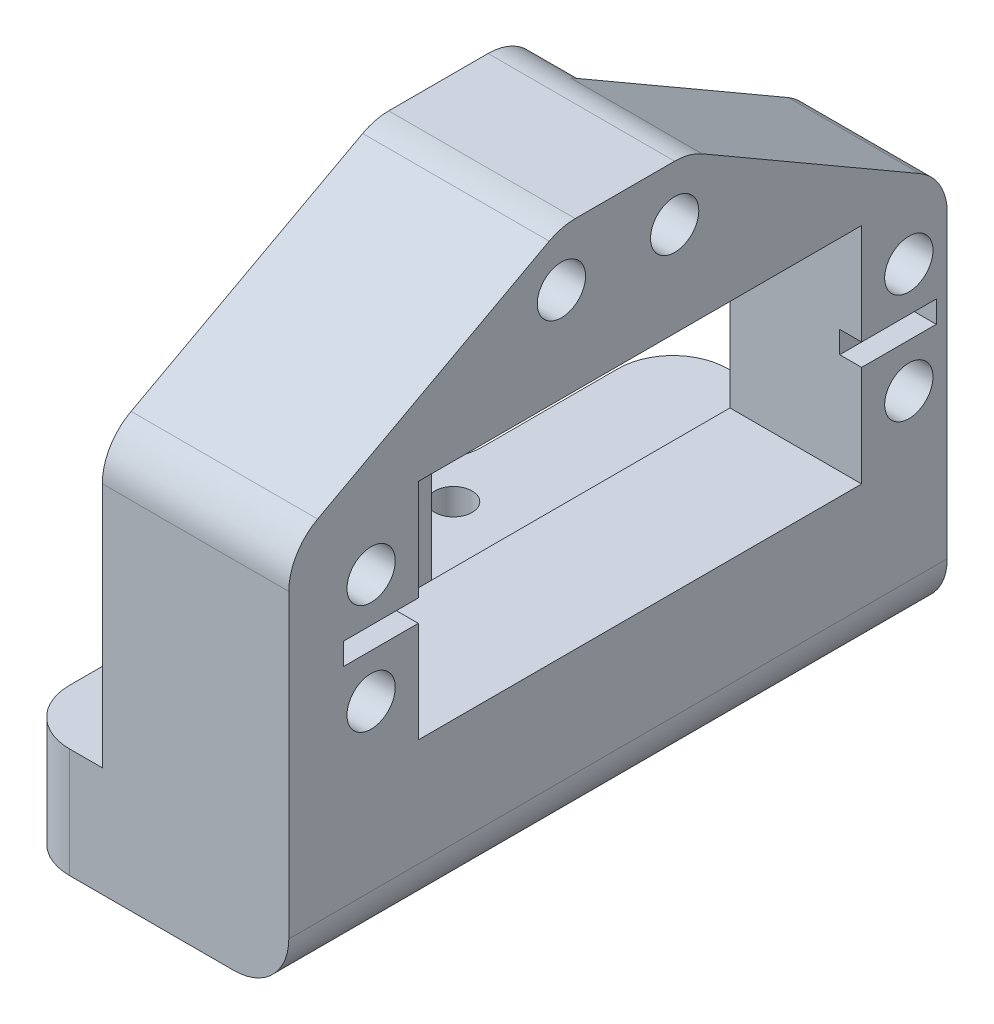
from build123d import *
from build123d.topology import SkipClean

# Parameters (mm, degrees)
SKETCH_1_W           = 20
SKETCH_1_H           = 60.00000000000001
SKETCH_1_R           = 1.7000000000000004
SKETCH_1_R_2         = 1.7
EXTRUDE_1_DEPTH      = 10
SKETCH_6_W           = 60.00000000000001
SKETCH_6_H           = 50.00000000000001
EXTRUDE_4_DEPTH      = 12
SKETCH_7_R           = 2.200000000000002
SKETCH_7_R_2         = 2.2
CUT_EXTRUDE_3_DEPTH  = 67.51315659326356
EXTRUDE_5_OUTLINE_R  = 2.2
EXTRUDE_5_DEPTH      = 5
CUT_EXTRUDE_7_DEPTH  = 5
SKETCH_14_R          = 2.2
CUT_EXTRUDE_8_DEPTH  = 5
CUT_EXTRUDE_START    = -17
CUT_EXTRUDE_9_DEPTH  = 17
SKETCH_18_W          = 6.800000000000008
SKETCH_18_H          = 2.000000000000014
SKETCH_18_W_2        = 6.799999999999994
SKETCH_18_H_2        = 2.0000000000000036
EXTRUDE_10_DEPTH     = 10
CUT_EXTRUDE_10_DEPTH = 62.35829229692095
CUT_EXTRUDE_11_DEPTH = 3.3
FILLET_1_R           = 5
FILLET_2_R           = 3


# Read off the part's stored shape, not the designer's step: 凸台-拉伸5
with BuildPart() as part:
    # 草图1 → 凸台-拉伸1 (new body)
    with BuildSketch(Plane(origin=(0, 0, 0), x_dir=(1, 0, 0), z_dir=(0, 1, 0))):
        Rectangle(SKETCH_1_W, SKETCH_1_H)
        with Locations(Location((-7.000000000000025, 5.2e-15, 0), (0, 0, 270))):
            Circle(SKETCH_1_R, mode=Mode.SUBTRACT)
        with Locations(Location((-2.429e-14, 5.2e-15, 0), (0, 0, 270))):
            Circle(SKETCH_1_R_2, mode=Mode.SUBTRACT)
        with Locations(Location((2.949e-14, 7.000000000000025, 0), (0, 0, 270))):
            Circle(SKETCH_1_R, mode=Mode.SUBTRACT)
        with Locations(Location((-4.48e-15, -7.000000000000048, 0), (0, 0, 270))):
            Circle(SKETCH_1_R, mode=Mode.SUBTRACT)
    extrude(amount=EXTRUDE_1_DEPTH)

    # 草图6 → 凸台-拉伸4 (add)
    with BuildSketch(Plane(origin=(10, 0, 0), x_dir=(0, 0, -1), z_dir=(1, 0, 0))):
        with Locations((0, 25.000000000000004)):
            Rectangle(SKETCH_6_W, SKETCH_6_H)
    extrude(amount=EXTRUDE_4_DEPTH)

    # 草图7 → 切除-拉伸3 (cut, through all)
    with BuildSketch(Plane(origin=(22, 0, 0), x_dir=(0, 0, -1), z_dir=(1, 0, 0))):
        with Locations((-22.500000000000014, 30)):
            Circle(SKETCH_7_R)
        with Locations((-22.500000000000014, 20)):
            Circle(SKETCH_7_R)
        Polygon((-18.20000000000001, 14.8), (22.199999999999985, 14.800000000000002), (22.199999999999985, 35.2), (-18.20000000000001, 35.2), align=None)
        with Locations((26.49999999999999, 30.000000000000007)):
            Circle(SKETCH_7_R)
        with Locations((26.49999999999999, 20.000000000000004)):
            Circle(SKETCH_7_R)
        Polygon((22.199999999999985, 26.00000000000001), (22.199999999999985, 23.999999999999996), (28.999999999999986, 24.000000000000004), (28.99999999999999, 26.00000000000001), align=None)
        Polygon((-25.000000000000014, 24), (-18.200000000000014, 24), (-18.20000000000001, 26.000000000000004), (-25.000000000000014, 26.000000000000004), align=None)
        with Locations((-5.159597133486693, 43.79385241571819)):
            Circle(SKETCH_7_R_2)
        with Locations((5.159597133486693, 43.79385241571819)):
            Circle(SKETCH_7_R_2)
    extrude(amount=-CUT_EXTRUDE_3_DEPTH, mode=Mode.SUBTRACT)

    # 凸台-拉伸5 outline → 凸台-拉伸5 (add)
    with SkipClean():  # the faces are left unmerged after this step: merging them gives an invalid solid
        with BuildSketch(Plane.ZY.offset(-10)):
            with BuildLine():
                Line((30, 10), (30, 35.4))
                Line((30, 35.4), (5.159597133, 48.793852416))
                Line((5.159597133, 48.793852416), (-5.159597133, 48.793852416))
                ThreePointArc((-5.159597133, 48.793852416), (-10.159597133, 43.793852416), (-5.159597133, 38.793852416))
                Line((-5.159597133, 38.793852416), (5, 38.793852416))
                Line((5, 38.793852416), (5, 10))
                Line((5, 10), (30, 10))
            make_face()
            with Locations((22.5, 20)):
                Circle(EXTRUDE_5_OUTLINE_R, mode=Mode.SUBTRACT)
            with Locations((-5.159597133, 43.793852416)):
                Circle(EXTRUDE_5_OUTLINE_R, mode=Mode.SUBTRACT)
            with Locations((5.159597133, 43.793852416)):
                Circle(EXTRUDE_5_OUTLINE_R, mode=Mode.SUBTRACT)
            with Locations((22.5, 30)):
                Circle(EXTRUDE_5_OUTLINE_R, mode=Mode.SUBTRACT)
        extrude(amount=EXTRUDE_5_DEPTH)

    # 草图13 → 切除-拉伸7 (cut)
    with BuildSketch(Plane.ZY.offset(-5)):
        with BuildLine():
            Line((26.400000000000016, 30), (26.400000000000016, 20))
            ThreePointArc((26.400000000000016, 20), (22.500000000000014, 16.099999999999998), (18.600000000000012, 20))
            Line((18.600000000000012, 20), (18.60000000000001, 30))
            ThreePointArc((18.60000000000001, 30), (22.500000000000014, 33.900000000000006), (26.400000000000016, 30))
        make_face()
    extrude(amount=-CUT_EXTRUDE_7_DEPTH, mode=Mode.SUBTRACT)

    # 草图14 → 切除-拉伸8 (cut)
    with BuildSketch(Plane(origin=(10, 0, 0), x_dir=(0, 0, -1), z_dir=(1, 0, 0))):
        with Locations((-11.800000000000018, 25)):
            Circle(SKETCH_14_R)
    extrude(amount=-CUT_EXTRUDE_8_DEPTH, mode=Mode.SUBTRACT)

    # 草图16 → 切除-拉伸9 (cut)
    with BuildSketch(Plane.ZY.offset(-5).offset(CUT_EXTRUDE_START)):
        with BuildLine():
            Line((5.159597133486693, 48.793852415718185), (30, 35.40000000000001))
            Line((30, 35.40000000000001), (30, 50))
            Line((30, 50), (-30, 50))
            Line((-30, 50), (-29.999999999999996, 35.2))
            Line((-29.999999999999996, 35.2), (-7.663336701878596, 48.121818239713186))
            ThreePointArc((-7.663336701878596, 48.121818239713186), (-6.455778231949604, 48.622922156360524), (-5.1595971334867095, 48.793852415718185))
            Line((-5.1595971334867095, 48.793852415718185), (5.159597133486693, 48.793852415718185))
        make_face()
    extrude(amount=CUT_EXTRUDE_9_DEPTH, mode=Mode.SUBTRACT)

    # 草图18 → 凸台-拉伸10 (add)
    with BuildSketch(Plane.ZY.offset(-10)):
        with Locations((-25.599999999999987, 25.000000000000004)):
            Rectangle(SKETCH_18_W, SKETCH_18_H)
        with Locations((21.60000000000001, 25)):
            Rectangle(SKETCH_18_W_2, SKETCH_18_H_2)
    extrude(amount=-EXTRUDE_10_DEPTH)

    # 草图19 → 切除-拉伸10 (cut, through all)
    with BuildSketch(Plane.XZ):
        with BuildLine():
            Line((-3.0000000000000244, 9.539392014169463), (-3.0000000000000244, 30))
            Line((-3.0000000000000244, 30), (-10, 30))
            Line((-10, 30), (-10, -1.2700383e-09))
            ThreePointArc((-10.000000000000028, -1.27003874e-09), (-8.06225774867426, 5.916079782587651), (-3.000000000000024, 9.539392014169465))
        make_face()
        with BuildLine():
            ThreePointArc((-3.0000000000000244, -9.539392014169461), (-8.062257747922892, -5.916079783611588), (-10.000000000000028, -1.27003874e-09))
            Line((-10, -1.2700383e-09), (-10, -30))
            Line((-10, -30), (-3.000000000000025, -30))
            Line((-3.0000000000000244, -30), (-3.0000000000000244, -9.539392014169465))
        make_face()
    extrude(amount=-CUT_EXTRUDE_10_DEPTH, mode=Mode.SUBTRACT)

    # 草图20 → 切除-拉伸11 (cut)
    with BuildSketch(Plane(origin=(10, 0, 0), x_dir=(0, 0, -1), z_dir=(1, 0, 0))):
        Polygon((-7.643078061834704, 24.999999999999993), (-9.721539030917363, 28.600000000000012), (-13.878460969082674, 28.600000000000012), (-15.956921938165337, 24.999999999999993), (-13.878460969082676, 21.399999999999984), (-9.721539030917361, 21.399999999999984), align=None)
    extrude(amount=-CUT_EXTRUDE_11_DEPTH, mode=Mode.SUBTRACT)

    # 圆角1
    fillet_1_edges = [part.edges().sort_by_distance(p)[0] for p in [
        (13.5, 35.400000000000006, 30),
        (16, 48.793852415718185, 5.159597133486693),
        (16, 35.2, -29.999999999999996),
        (-3.0000000000000244, 5, 30),
        (-3.000000000000024, 5, 9.539392014169465),
        (-3.000000000000025, 5, -30),
        (-3.000000000000025, 5, -9.539392014169465),
        (22, 0, 0),
    ]]
    fillet(fillet_1_edges, radius=FILLET_1_R)

    # 圆角2
    fillet_2_edges = [part.edges().sort_by_distance(p)[0] for p in [
        (7.5, 38.793852416, 5),
        (7.5, 10, 5),
    ]]
    fillet(fillet_2_edges, radius=FILLET_2_R)


solid = part.part
